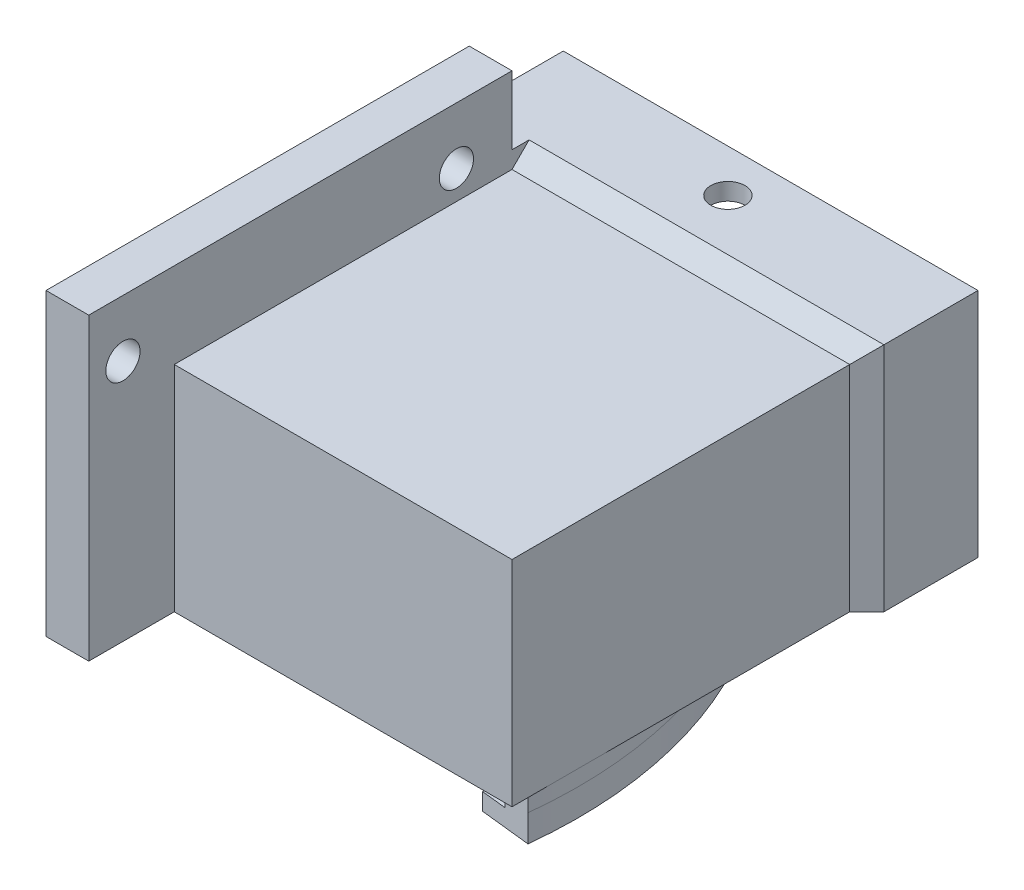
from build123d import *

# Parameters (mm, degrees)
SKETCH1_W                = 44.5
SKETCH1_H                = 25.05
SKETCH1_W_2              = 39.9
SKETCH1_H_2              = 18.45
BOSS_EXTRUDE1_DEPTH      = 40
BOSS_EXTRUDE2_START      = 40
BOSS_EXTRUDE2_OUTLINE_W  = 44.5
BOSS_EXTRUDE2_OUTLINE_H  = 25.05
BOSS_EXTRUDE2_DEPTH      = 2.5
BOSS_EXTRUDE3_DEPTH      = 3
BOSS_EXTRUDE3_DEPTH_BACK = 10
SKETCH1_4_W              = 48.5
SKETCH1_4_H              = 27.05
SKETCH1_4_W_2            = 44.5
SKETCH1_4_H_2            = 23.05
SKETCH2_W                = 5
SKETCH2_H                = 25.05
BOSS_EXTRUDE4_DEPTH      = 10
CUT_EXTRUDE1_REACH       = 65.844
SKETCH7_W                = 5
SKETCH7_H                = 49.5
BOSS_EXTRUDE5_DEPTH      = 10
SKETCH8_R                = 2
CUT_EXTRUDE2_DEPTH       = 5.8
CHAMFER1_SIZE            = 2
CHAMFER2_SIZE            = 2
SKETCH9_R                = 2
CUT_EXTRUDE3_DEPTH       = 10


# Read off the part's stored shape, not the designer's step: Boss-Extrude2
with BuildPart() as part:
    # Sketch1 → Boss-Extrude1 (new body)
    with BuildSketch(Plane.XY):
        with Locations((0, -1)):
            Rectangle(SKETCH1_W, SKETCH1_H)
        Rectangle(SKETCH1_W_2, SKETCH1_H_2, mode=Mode.SUBTRACT)
    extrude(amount=BOSS_EXTRUDE1_DEPTH)

    # Boss-Extrude2 outline → Boss-Extrude2 (add)
    with BuildSketch(Plane.XY.offset(BOSS_EXTRUDE2_START)):
        with Locations((0, -1)):
            Rectangle(BOSS_EXTRUDE2_OUTLINE_W, BOSS_EXTRUDE2_OUTLINE_H)
    extrude(amount=BOSS_EXTRUDE2_DEPTH)

    # Sketch1<4> → Boss-Extrude3 (add, two sides: drawn at the far end of the back side and taken through both)
    with BuildSketch(Plane.XY.offset(-BOSS_EXTRUDE3_DEPTH_BACK)):
        Rectangle(SKETCH1_4_W, SKETCH1_4_H)
        Rectangle(SKETCH1_4_W_2, SKETCH1_4_H_2, mode=Mode.SUBTRACT)
    extrude(amount=BOSS_EXTRUDE3_DEPTH + BOSS_EXTRUDE3_DEPTH_BACK)

    # Sketch2 → Boss-Extrude4 (add)
    with BuildSketch(Plane.XY.offset(42.5)):
        with Locations((-19.75, -1)):
            Rectangle(SKETCH2_W, SKETCH2_H)
    extrude(amount=BOSS_EXTRUDE4_DEPTH)

    # Sweep1: sweep along a path in Sketch4
    with BuildLine(Plane.XZ.offset(13.525)) as sweep1_path:
        ThreePointArc((1.009931304, -3.080074503), (15.529238499, 16.150172823), (18.964123835, 40))
    # Sketch6 → Sweep1 (sweep)
    with BuildSketch(Plane(origin=(18.964123835, -13.525, 40), x_dir=(0.9940873595600267, 0, 0.10858324715615325), z_dir=(-0.10858324715615325, 0, 0.9940873595600267))):
        Polygon((-0.007155114, -3), (-3.007155114, -3), (-3.007155114, -5), (2.992844886, -5), (2.992844886, -1.848135777), (2.992844886, 0), (-0.007155114, 0), align=None)
    sweep(path=sweep1_path.line)

    # Sketch4<3> → Cut-Extrude1 (cut, up to next)
    with BuildSketch(Plane.XZ.offset(13.525), mode=Mode.PRIVATE) as cut_extrude1_sk1:
        with BuildLine():
            Line((-14.565566912, 40), (14.442409674, 40))
            ThreePointArc((14.442409674, 40), (14.628132166, 31.380371303), (13.124010953, 22.890959598))
            Line((13.124010953, 22.890959598), (-8.565566912, 22.890959598))
            ThreePointArc((-8.565566912, 22.890959598), (-12.808207599, 24.648318911), (-14.565566912, 28.890959598))
            Line((-14.565566912, 28.890959598), (-14.565566912, 40))
        make_face()
    cut_extrude1_tool1 = extrude(cut_extrude1_sk1.sketch, amount=-CUT_EXTRUDE1_REACH, mode=Mode.PRIVATE) & part.part
    add(cut_extrude1_tool1.solids().sort_by_distance((0.104414, -13.525, 31.62544))[0], mode=Mode.SUBTRACT)

    # Sketch7 → Boss-Extrude5 (add)
    with BuildSketch(Plane(origin=(0, 11.525, 0), x_dir=(1, 0, 0), z_dir=(0, 1, 0))):
        with Locations((-19.75, -27.75)):
            Rectangle(SKETCH7_W, SKETCH7_H)
    extrude(amount=BOSS_EXTRUDE5_DEPTH)

    # Sketch8 → Cut-Extrude2 (cut)
    with BuildSketch(Plane.ZY.offset(22.25)):
        with Locations(Location((48.5, 14.875, 0), (0, 0, 270))):
            Circle(SKETCH8_R)
        with Locations(Location((9.5, 14.875, 0), (0, 0, 270))):
            Circle(SKETCH8_R)
    extrude(amount=-CUT_EXTRUDE2_DEPTH, mode=Mode.SUBTRACT)

    # Chamfer1
    chamfer1_edges = [part.edges().sort_by_distance(p)[0] for p in [
        (3.5, 13.525, 3),
    ]]
    chamfer(chamfer1_edges, length=CHAMFER1_SIZE - 0.0001)  # a hair under: the kernel refuses the full size

    # Chamfer2
    chamfer2_edges = [part.edges().sort_by_distance(p)[0] for p in [
        (24.25, -0.99995, 3),
    ]]
    chamfer(chamfer2_edges, length=CHAMFER2_SIZE)

    # Sketch9 → Cut-Extrude3 (cut)
    with BuildSketch(Plane(origin=(0, 13.525, 0), x_dir=(1, 0, 0), z_dir=(0, 1, 0))):
        with Locations(Location((0, 5, 0), (0, 0, 180))):
            Circle(SKETCH9_R)
    extrude(amount=-CUT_EXTRUDE3_DEPTH, mode=Mode.SUBTRACT)


solid = part.part
